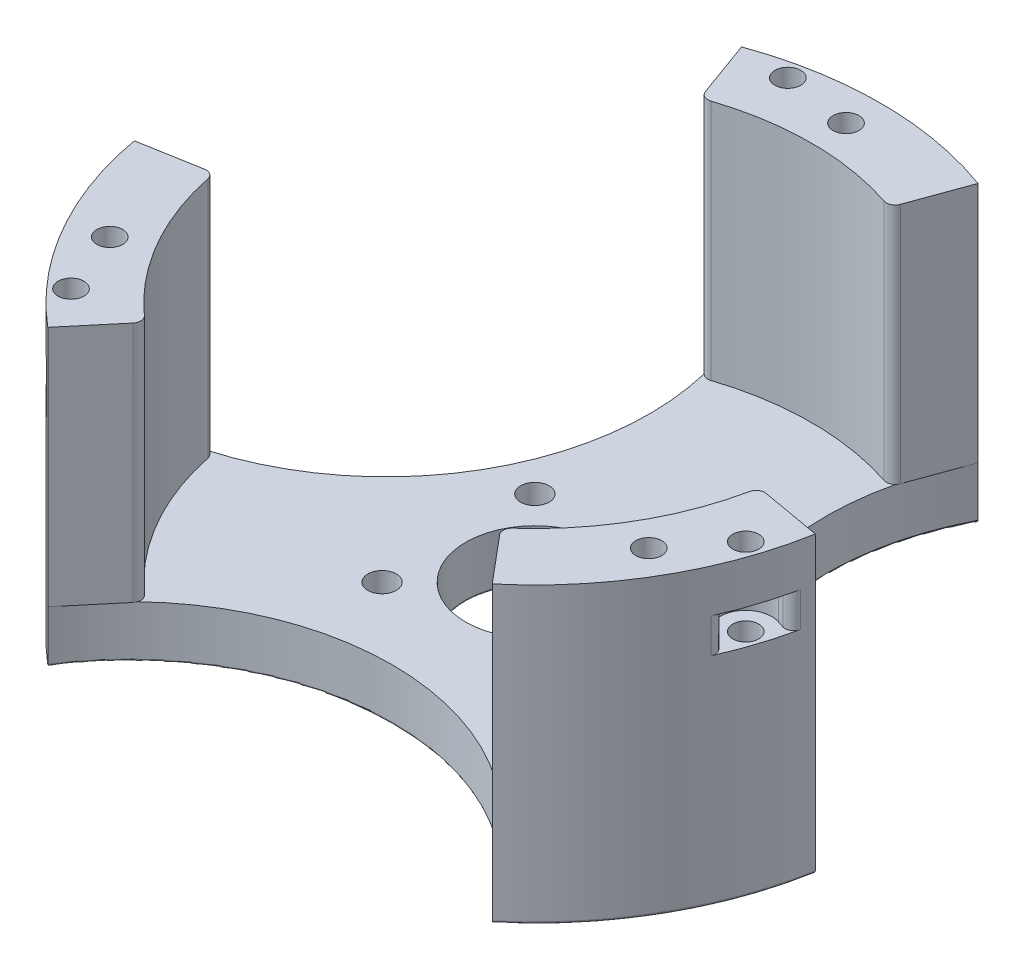
from build123d import *

# Parameters (mm, degrees)
SKETCH1_R                = 40
SKETCH1_R_2              = 1.65
BOSS_EXTRUDE1_DEPTH      = 6
SKETCH2_R                = 1.5
BOSS_EXTRUDE2_DEPTH      = 28
SKETCH16_R               = 1.5
CUT_EXTRUDE9_DEPTH       = 67
CIRPATTERN1_COUNT        = 3
SKETCH3_R                = 8
CUT_EXTRUDE1_DEPTH       = 10
SKETCH4_R                = 3.5
CUT_EXTRUDE2_DEPTH       = 3
SKETCH5_R                = 30.471270003
CUT_EXTRUDE3_DEPTH       = 64.118935352
CIRPATTERN2_COUNT        = 3
FILLET1_R                = 0.25
FILLET2_R                = 1
SKETCH9_R                = 1.5
CUT_EXTRUDE4_DEPTH       = 64.188243513
CUT_EXTRUDE5_DEPTH       = 4
FILLET3_R                = 1
CIRPATTERN3_COUNT        = 3
FILLET3_OF_CIRPATTERN3_R = 1


with BuildPart() as part:
    # Sketch1 → Boss-Extrude1 (new body)
    with BuildSketch(Plane(origin=(0, 0, 0), x_dir=(1, 0, 0), z_dir=(0, 1, 0))):
        with Locations(Location((0, 0, 0), (0, 0, 270))):
            Circle(SKETCH1_R)
        with Locations(Location((-8.838834765, 8.838834765, 0), (0, 0, 270))):
            Circle(SKETCH1_R_2, mode=Mode.SUBTRACT)
        with Locations(Location((8.838834765, 8.838834765, 0), (0, 0, 270))):
            Circle(SKETCH1_R_2, mode=Mode.SUBTRACT)
        with Locations(Location((8.838834765, -8.838834765, 0), (0, 0, 270))):
            Circle(SKETCH1_R_2, mode=Mode.SUBTRACT)
        with Locations(Location((-8.838834765, -8.838834765, 0), (0, 0, 270))):
            Circle(SKETCH1_R_2, mode=Mode.SUBTRACT)
    extrude(amount=BOSS_EXTRUDE1_DEPTH)

    # Sketch2 → Boss-Extrude2 (add)
    with BuildSketch(Plane(origin=(0, 6, 0), x_dir=(1, 0, 0), z_dir=(0, 1, 0))):
        with BuildLine():
            Line((-13.680805733, 37.587704831), (-10.944644586, 30.070163865))
            ThreePointArc((-10.944644586, 30.070163865), (0, 32), (10.944644586, 30.070163865))
            Line((10.944644586, 30.070163865), (13.680805733, 37.587704831))
            ThreePointArc((13.680805733, 37.587704831), (0, 40), (-13.680805733, 37.587704831))
        make_face()
        with Locations(Location((0, 36, 0), (0, 0, 270))):
            Circle(SKETCH2_R, mode=Mode.SUBTRACT)
    boss_extrude2 = extrude(amount=BOSS_EXTRUDE2_DEPTH)

    # Sketch16 → Cut-Extrude9 (cut, through all)
    with BuildSketch(Plane(origin=(0, 34, 0), x_dir=(1, 0, 0), z_dir=(0, 1, 0))):
        with Locations(Location((0, 36, 0), (0, 0, 270))):
            Circle(SKETCH16_R)
    cut_extrude9 = extrude(amount=-CUT_EXTRUDE9_DEPTH, mode=Mode.SUBTRACT)

    # CirPattern1: Boss-Extrude2, Cut-Extrude9 ×3 about axis
    cirpattern1_axis = Axis((0, 0, 0), (0, 1, 0))
    add([boss_extrude2.rotate(cirpattern1_axis, i * 360 / CIRPATTERN1_COUNT) for i in range(1, CIRPATTERN1_COUNT)])
    add([cut_extrude9.rotate(cirpattern1_axis, i * 360 / CIRPATTERN1_COUNT) for i in range(1, CIRPATTERN1_COUNT)], mode=Mode.SUBTRACT)

    # Sketch3 → Cut-Extrude1 (cut)
    with BuildSketch(Plane(origin=(0, 6, 0), x_dir=(1, 0, 0), z_dir=(0, 1, 0))):
        with Locations(Location((0, 0, 0), (0, 0, 270))):
            Circle(SKETCH3_R)
    extrude(amount=-CUT_EXTRUDE1_DEPTH, mode=Mode.SUBTRACT)

    # Sketch4 → Cut-Extrude2 (cut)
    with BuildSketch(Plane.XZ):
        with Locations(Location((8.838834765, 8.838834765, 0), (0, 0, 270))):
            Circle(SKETCH4_R)
        with Locations(Location((8.838834765, -8.838834765, 0), (0, 0, 270))):
            Circle(SKETCH4_R)
        with Locations(Location((-8.838834765, -8.838834765, 0), (0, 0, 270))):
            Circle(SKETCH4_R)
        with Locations(Location((-8.838834765, 8.838834765, 0), (0, 0, 270))):
            Circle(SKETCH4_R)
    extrude(amount=-CUT_EXTRUDE2_DEPTH, mode=Mode.SUBTRACT)

    # Sketch5 → Cut-Extrude3 (cut, through all)
    with BuildSketch(Plane(origin=(0, 6, 0), x_dir=(1, 0, 0), z_dir=(0, 1, 0))):
        with Locations((40.698571494, 23.497331208)):
            Circle(SKETCH5_R)
    cut_extrude3 = extrude(amount=-CUT_EXTRUDE3_DEPTH, mode=Mode.SUBTRACT)

    # CirPattern2: Cut-Extrude3 ×3 about axis
    cirpattern2_axis = Axis((0, 0, 0), (0, 1, 0))
    for i in range(1, CIRPATTERN2_COUNT):
        add(cut_extrude3.rotate(cirpattern2_axis, i * 360 / CIRPATTERN2_COUNT), mode=Mode.SUBTRACT)

    # Fillet1
    fillet1_edges = [part.edges().sort_by_distance(p)[0] for p in [
        (-8.838834765, 0, -5.338834765),
        (8.838834765, 0, -5.338834765),
        (8.838834765, 0, 12.338834765),
        (0, 0, -40),
        (14.309677586, 0, -8.261696207),
        (-34.641016151, 0, 20),
        (34.641016151, 0, 20),
        (-14.309677586, 0, -8.261696207),
        (0, 0, 16.523392413),
        (0, 0, -37.5),
        (-32.475952642, 0, 18.75),
        (32.475952642, 0, 18.75),
        (0, 0, -8),
        (-8.838834765, 0, 12.338834765),
    ]]
    fillet(fillet1_edges, radius=FILLET1_R)

    # Fillet2
    # the kernel refuses this fillet: 1 mm, written as the material it takes off along each edge
    with BuildSketch(Plane(origin=(-10.944644586, 6, -30.070163865), x_dir=(-0.3420201433256649, 0, -0.9396926207859098), z_dir=(0, 1, 0)), Plane(origin=(-20.56920351, 6, 24.51342218), x_dir=(-0.6427876096865415, 0, 0.7660444431189762), z_dir=(0, 1, 0))) as fillet2_piece_1:
        with BuildLine():
            CenterArc((0.984845005, -1), FILLET2_R, 90, 88.263498424)
            ThreePointArc((-0.014695753, -0.96969697), (-0.003674149, -0.48490416), (0, 0))
            Line((0, 0), (0.984845005, 0))
        make_face()
    extrude(amount=30.462112512, mode=Mode.SUBTRACT)
    with BuildSketch(Plane(origin=(10.944644586, 6, -30.070163865), x_dir=(0.34202014332567066, 0, -0.9396926207859077), z_dir=(0, 1, 0)), Plane(origin=(-31.513848096, 6, 5.556741685), x_dir=(-0.9848077530122085, 0, 0.17364817766692828), z_dir=(0, 1, 0))) as fillet2_piece_2:
        with BuildLine():
            CenterArc((0.984845005, 1), FILLET2_R, 181.736501576, 88.263498424)
            ThreePointArc((-0.014695753, 0.96969697), (-0.003674149, 0.48490416), (0, 0))
            Line((0, 0), (0.984845005, 0))
        make_face()
    extrude(amount=30.462112512, mode=Mode.SUBTRACT)
    with BuildSketch(Plane(origin=(31.513848096, 6, 5.556741685), x_dir=(-0.1885512828888332, 0, 0.9820633450653655), z_dir=(0, 1, 0))) as fillet2_piece_3:
        with BuildLine():
            CenterArc((0.984961575, 0.999885183), FILLET2_R, 180.868250788, 88.263498424)
            Line((-0.014923608, 0.984731928), (0, 0))
            ThreePointArc((0, 0), (0.48490416, 0.003674149), (0.96980832, 0))
        make_face()
    extrude(amount=30.462112512, mode=Mode.SUBTRACT)
    with BuildSketch(Plane(origin=(20.56920351, 6, 24.51342218), x_dir=(0.7562161635077187, 0, -0.6543218734305519), z_dir=(0, 1, 0))) as fillet2_piece_4:
        with BuildLine():
            CenterArc((0.984961575, -0.999885183), FILLET2_R, 90.868250788, 88.263498424)
            Line((-0.014923608, -0.984731928), (0, 0))
            ThreePointArc((0, 0), (0.48490416, -0.003674149), (0.96980832, 0))
        make_face()
    extrude(amount=30.462112512, mode=Mode.SUBTRACT)

    # Sketch9 → Cut-Extrude4 (cut, symmetric)
    with BuildSketch(Plane(origin=(0, 29, 0), x_dir=(1, 0, 0), z_dir=(0, 1, 0))):
        with Locations(Location((-7.900644251, 37.169608828, 0), (0, 0, 270))):
            Circle(SKETCH9_R)
    cut_extrude4 = extrude(amount=CUT_EXTRUDE4_DEPTH, both=True, mode=Mode.SUBTRACT)

    # Sketch10 → Cut-Extrude5 (cut)
    with BuildSketch(Plane(origin=(0, 29, 0), x_dir=(1, 0, 0), z_dir=(0, 1, 0))):
        with BuildLine():
            Line((-11.562777971, 39.969390358), (-10.835087053, 36.545873755))
            ThreePointArc((-10.835087053, 36.545873755), (-7.276909179, 34.235166026), (-4.966201449, 37.7933439))
            Line((-4.966201449, 37.7933439), (-5.693892367, 41.216860503))
            Line((-5.693892367, 41.216860503), (-11.562777971, 39.969390358))
        make_face()
    cut_extrude5 = extrude(amount=-CUT_EXTRUDE5_DEPTH, mode=Mode.SUBTRACT)

    # Fillet3
    fillet3_edges = [part.edges().sort_by_distance(p)[0] for p in [
        (-11.227487385, 27, -38.391972169),
        (-5.35860178, 27, -39.639442314),
    ]]
    fillet(fillet3_edges, radius=FILLET3_R)

    # CirPattern3: Cut-Extrude4, Cut-Extrude5 ×3 about axis
    cirpattern3_axis = Axis((0, 0, 0), (0, 1, 0))
    add([cut_extrude4.rotate(cirpattern3_axis, i * 360 / CIRPATTERN3_COUNT) for i in range(1, CIRPATTERN3_COUNT)], mode=Mode.SUBTRACT)
    add([cut_extrude5.rotate(cirpattern3_axis, i * 360 / CIRPATTERN3_COUNT) for i in range(1, CIRPATTERN3_COUNT)], mode=Mode.SUBTRACT)

    # Fillet3 of CirPattern3
    fillet3_of_cirpattern3_edges = [part.edges().sort_by_distance(p)[0] for p in [
        (-27.634679507, 27, 28.91927538),
        (-31.649463146, 27, 24.460406427),
        (38.862166892, 27, 9.472696789),
        (37.008064926, 27, 15.179035887),
    ]]
    fillet(fillet3_of_cirpattern3_edges, radius=FILLET3_OF_CIRPATTERN3_R)


solid = part.part
